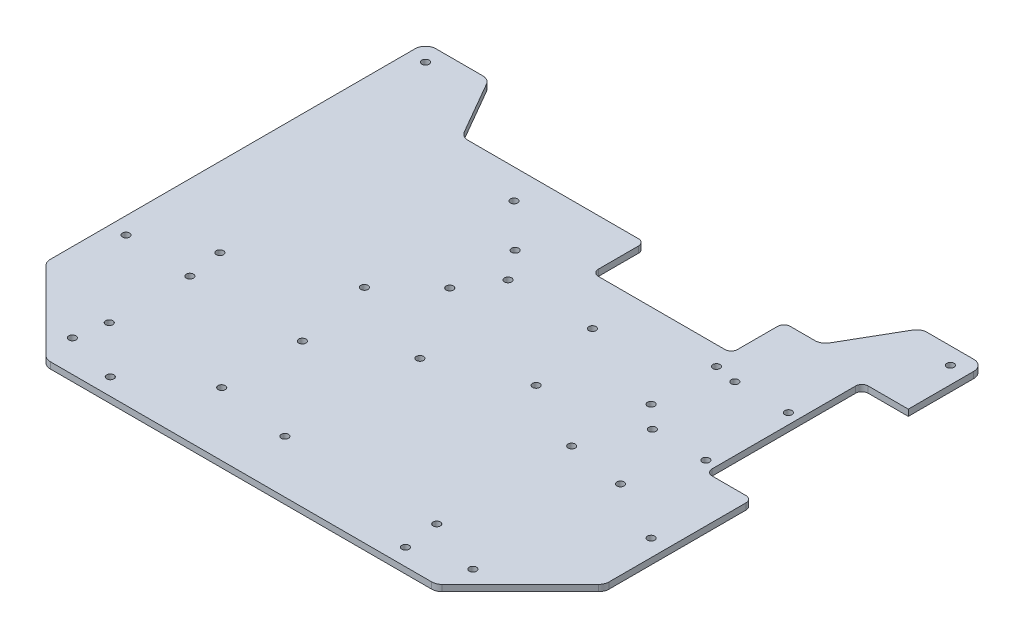
from build123d import *

# Parameters (mm, degrees)
BOSS_EXTRU_1_DEPTH           = 3
CONG_1_R                     = 5
ESQUISSE2_R                  = 1
ENL_V_MAT_EXTRU_1_DEPTH      = 3
D_GAGEMENT_M31_D             = 3.4
ESQUISSE5_W                  = 66
ESQUISSE5_H                  = 25
ESQUISSE5_W_2                = 22
ESQUISSE5_H_2                = 74
ENL_V_MAT_EXTRU_2_DEPTH      = 257.837010573
CONG_2_R                     = 3
ESQUISSE6_R                  = 1
ENL_V_MAT_EXTRU_3_DEPTH      = 257.837010573
D_GAGEMENT_M32_D             = 3.4
D_GAGEMENT_M32_DEPTH         = 10
D_GAGEMENT_M32_TIP           = 1.021463052
ESQUISSE9_R                  = 1
ENL_V_MAT_EXTRU_4_DEPTH      = 257.837010573
D_GAGEMENT_M33_D             = 3.4
D_GAGEMENT_M33_DEPTH         = 10
D_GAGEMENT_M33_TIP           = 1.021463052
ENL_V_MAT_EXTRU_5_DEPTH      = 257.837010573
ENL_V_MAT_EXTRU_5_DEPTH_BACK = 257.837010573
ESQUISSE12_R                 = 1
D_GAGEMENT_M34_D             = 3.4
D_GAGEMENT_M34_DEPTH         = 10
D_GAGEMENT_M34_TIP           = 1.021463052
D_GAGEMENT_M35_D             = 3.4
D_GAGEMENT_M35_DEPTH         = 10
D_GAGEMENT_M35_TIP           = 1.021463052


with BuildPart() as part:
    # Esquisse1 → Boss.-Extru.1 (new body)
    with BuildSketch(Plane(origin=(0, 0, 0), x_dir=(1, 0, 0), z_dir=(0, 1, 0))):
        Polygon((-92.5, 0), (92.5, 0), (132.5, 40), (132.5, 220), (102.5, 220), (85.179491924, 190), (-85.179491924, 190), (-102.5, 220), (-132.5, 220), (-132.5, 40), align=None)
    extrude(amount=BOSS_EXTRU_1_DEPTH)

    # Congé1
    cong_1_edges = [part.edges().sort_by_distance(p)[0] for p in [
        (92.5, 1.5, 0),
        (132.5, 1.5, -40),
        (132.5, 1.5, -220),
        (102.5, 1.5, -220),
        (85.179491924, 1.5, -190),
        (-85.179491924, 1.5, -190),
        (-102.5, 1.5, -220),
        (-132.5, 1.5, -220),
        (-92.5, 1.5, 0),
        (-132.5, 1.5, -40),
    ]]
    fillet(cong_1_edges, radius=CONG_1_R)

    # Esquisse2 → Enlèv. mat.-Extru.1 (cut)
    with BuildSketch(Plane(origin=(0, 3, 0), x_dir=(1, 0, 0), z_dir=(0, 1, 0))):
        with Locations((70, 8)):
            Circle(ESQUISSE2_R)
        with Locations((124.5, 70)):
            Circle(ESQUISSE2_R)
        with Locations((124.5, 212)):
            Circle(ESQUISSE2_R)
        with Locations((-124.5, 212)):
            Circle(ESQUISSE2_R)
        with Locations((-124.5, 70)):
            Circle(ESQUISSE2_R)
        with Locations((-70, 8)):
            Circle(ESQUISSE2_R)
    extrude(amount=-ENL_V_MAT_EXTRU_1_DEPTH, mode=Mode.SUBTRACT)

    # Dégagement M31 (through all)
    with Locations(Plane(origin=(0, 3, 0), x_dir=(1, 0, 0), z_dir=(0, 1, 0))):
        with Locations((70, 8), (-70, 8), (-124.5, 70), (-124.5, 212), (124.5, 212), (124.5, 70)):
            Hole(D_GAGEMENT_M31_D / 2)

    # Esquisse5 → Enlèv. mat.-Extru.2 (cut, through all)
    with BuildSketch(Plane(origin=(0, 3, 0), x_dir=(1, 0, 0), z_dir=(0, 1, 0))):
        with Locations((34.5, 177.5)):
            Rectangle(ESQUISSE5_W, ESQUISSE5_H)
        with Locations((121.5, 147)):
            Rectangle(ESQUISSE5_W_2, ESQUISSE5_H_2)
    extrude(amount=-ENL_V_MAT_EXTRU_2_DEPTH, mode=Mode.SUBTRACT)

    # Congé2
    cong_2_edges = [part.edges().sort_by_distance(p)[0] for p in [
        (132.5, 1.5, -110),
        (110.5, 1.5, -110),
        (110.5, 1.5, -184),
        (67.5, 1.5, -190),
        (67.5, 1.5, -165),
        (1.5, 1.5, -165),
        (1.5, 1.5, -190),
    ]]
    fillet(cong_2_edges, radius=CONG_2_R)

    # Esquisse6 → Enlèv. mat.-Extru.3 (cut, through all)
    with BuildSketch(Plane(origin=(0, 3, 0), x_dir=(1, 0, 0), z_dir=(0, 1, 0))):
        with Locations((69.5, 156)):
            Circle(ESQUISSE6_R)
        with Locations((-26, 156)):
            Circle(ESQUISSE6_R)
        with Locations((-46.5, 176)):
            Circle(ESQUISSE6_R)
        with Locations((69.5, 125)):
            Circle(ESQUISSE6_R)
        with Locations((-26, 125)):
            Circle(ESQUISSE6_R)
        with Locations((-46.5, 105)):
            Circle(ESQUISSE6_R)
    extrude(amount=-ENL_V_MAT_EXTRU_3_DEPTH, mode=Mode.SUBTRACT)

    # Dégagement M32
    with Locations(Plane(origin=(0, 3, 0), x_dir=(1, 0, 0), z_dir=(0, 1, 0))):
        with Locations((-46.5, 105), (-26, 125), (-26, 156), (-46.5, 176), (69.5, 156), (69.5, 125)):
            Hole(D_GAGEMENT_M32_D / 2, depth=D_GAGEMENT_M32_DEPTH)
            with Locations((0, 0, -(D_GAGEMENT_M32_DEPTH + D_GAGEMENT_M32_TIP / 2))):  # 118° drill point
                Cone(0, D_GAGEMENT_M32_D / 2, D_GAGEMENT_M32_TIP, mode=Mode.SUBTRACT)

    # Esquisse9 → Enlèv. mat.-Extru.4 (cut, through all)
    with BuildSketch(Plane(origin=(0, 3, 0), x_dir=(1, 0, 0), z_dir=(0, 1, 0))):
        with Locations((105.5, 115)):
            Circle(ESQUISSE9_R)
        with Locations((105.5, 154.12)):
            Circle(ESQUISSE9_R)
        with Locations((-92.5, 68.24)):
            Circle(ESQUISSE9_R)
        with Locations((-39.16, 68.24)):
            Circle(ESQUISSE9_R)
        with Locations((-39.16, 30)):
            Circle(ESQUISSE9_R)
        with Locations((-92.5, 30)):
            Circle(ESQUISSE9_R)
        with Locations((-4.16, 89)):
            Circle(ESQUISSE9_R)
        with Locations((67.84, 89)):
            Circle(ESQUISSE9_R)
        with Locations((-4.16, 25)):
            Circle(ESQUISSE9_R)
        with Locations((67.84, 25)):
            Circle(ESQUISSE9_R)
        with Locations((-15.5, 142.16060556)):
            Circle(ESQUISSE9_R)
        with Locations((24.5, 142.16060556)):
            Circle(ESQUISSE9_R)
        with Locations((34.5, 105.5)):
            Circle(ESQUISSE9_R)
        with Locations((80.1, 115)):
            Circle(ESQUISSE9_R)
        with Locations((80.1, 154.12)):
            Circle(ESQUISSE9_R)
    extrude(amount=-ENL_V_MAT_EXTRU_4_DEPTH, mode=Mode.SUBTRACT)

    # Dégagement M33
    with Locations(Plane(origin=(0, 3, 0), x_dir=(1, 0, 0), z_dir=(0, 1, 0))):
        with Locations((105.5, 115), (105.5, 154.12), (80.1, 154.12), (80.1, 115)):
            Hole(D_GAGEMENT_M33_D / 2, depth=D_GAGEMENT_M33_DEPTH)
            with Locations((0, 0, -(D_GAGEMENT_M33_DEPTH + D_GAGEMENT_M33_TIP / 2))):  # 118° drill point
                Cone(0, D_GAGEMENT_M33_D / 2, D_GAGEMENT_M33_TIP, mode=Mode.SUBTRACT)

    # Esquisse12 → Enlèv. mat.-Extru.5 (cut, two sides: drawn at the far end of the back side and taken through both)
    with BuildSketch(Plane(origin=(0, 3, 0), x_dir=(1, 0, 0), z_dir=(0, 1, 0)).offset(-ENL_V_MAT_EXTRU_5_DEPTH_BACK)):
        with Locations((-95, 85)):
            Circle(ESQUISSE12_R)
        with Locations((95, 85)):
            Circle(ESQUISSE12_R)
        with Locations((95, 15)):
            Circle(ESQUISSE12_R)
        with Locations((-95, 15)):
            Circle(ESQUISSE12_R)
    extrude(amount=ENL_V_MAT_EXTRU_5_DEPTH + ENL_V_MAT_EXTRU_5_DEPTH_BACK, mode=Mode.SUBTRACT)

    # Dégagement M34
    with Locations(Plane(origin=(0, 3, 0), x_dir=(1, 0, 0), z_dir=(0, 1, 0))):
        with Locations((-92.5, 68.24), (-92.5, 30), (-39.16, 30), (-39.16, 68.24), (-4.16, 25), (67.84, 25), (-4.16, 89), (67.84, 89), (34.5, 105.5), (24.5, 142.16060556), (-15.5, 142.16060556)):
            Hole(D_GAGEMENT_M34_D / 2, depth=D_GAGEMENT_M34_DEPTH)
            with Locations((0, 0, -(D_GAGEMENT_M34_DEPTH + D_GAGEMENT_M34_TIP / 2))):  # 118° drill point
                Cone(0, D_GAGEMENT_M34_D / 2, D_GAGEMENT_M34_TIP, mode=Mode.SUBTRACT)

    # Dégagement M35
    with Locations(Plane(origin=(0, 3, 0), x_dir=(1, 0, 0), z_dir=(0, 1, 0))):
        with Locations((-95, 15), (-95, 85), (95, 85), (95, 15)):
            Hole(D_GAGEMENT_M35_D / 2, depth=D_GAGEMENT_M35_DEPTH)
            with Locations((0, 0, -(D_GAGEMENT_M35_DEPTH + D_GAGEMENT_M35_TIP / 2))):  # 118° drill point
                Cone(0, D_GAGEMENT_M35_D / 2, D_GAGEMENT_M35_TIP, mode=Mode.SUBTRACT)


solid = part.part
